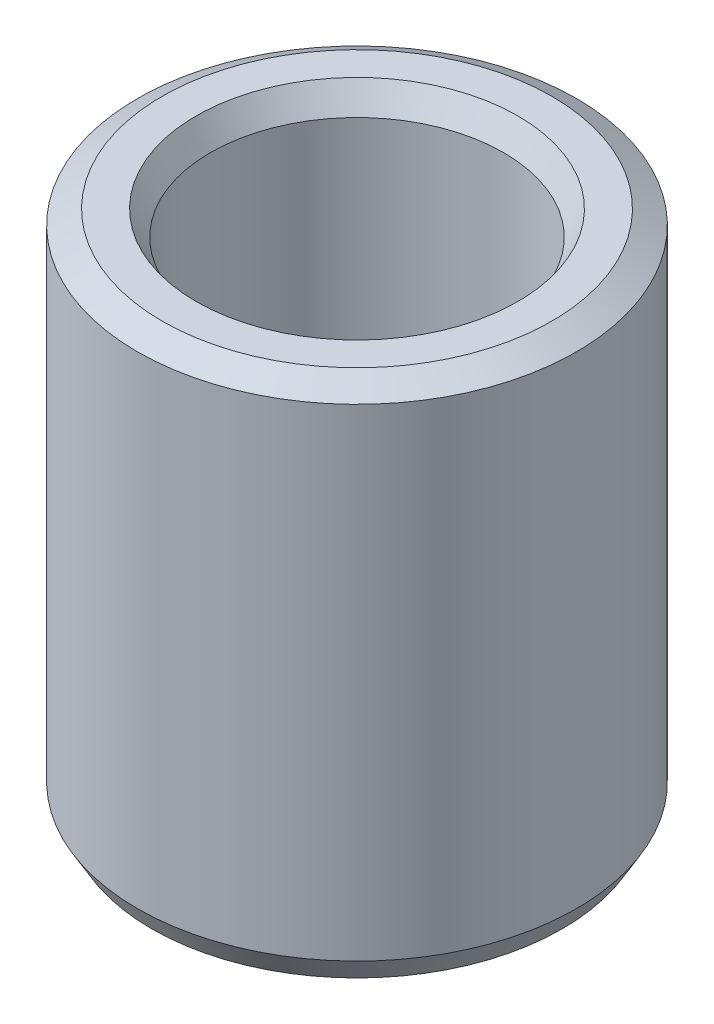
from build123d import *
from OCP.BRepFilletAPI import BRepFilletAPI_MakeChamfer

# Parameters (mm, degrees)
SKETCH1_R           = 35
BOSS_EXTRUDE1_DEPTH = 83.103015643
SKETCH2_R           = 23.377698066
CUT_EXTRUDE1_DEPTH  = 97.726993176
CHAMFER1_SIZE       = 2.271240368
CHAMFER1_SIZE2      = 3.933903713


with BuildPart() as part:
    # Sketch1 → Boss-Extrude1 (new body)
    with BuildSketch(Plane(origin=(0, 0, 0), x_dir=(1, 0, 0), z_dir=(0, 1, 0))):
        Circle(SKETCH1_R)
    extrude(amount=BOSS_EXTRUDE1_DEPTH)

    # Sketch2 → Cut-Extrude1 (cut, through all)
    with BuildSketch(Plane(origin=(0, 0, 0), x_dir=(1, 0, 0), z_dir=(0, 1, 0))):
        Circle(SKETCH2_R)
    extrude(amount=CUT_EXTRUDE1_DEPTH, mode=Mode.SUBTRACT)

    # Chamfer1: one chamfer whose edges measure the first distance from different faces: ONE call of the kernel's chamfer builder (chamfer() names one face for all edges)
    chamfer1_edges_1 = [part.edges().sort_by_distance(p)[0] for p in [
        (-23.377698066, 83.103015643, 0),
    ]]
    chamfer1_side_1 = [part.faces().sort_by_distance(p)[0] for p in [
        (-34.010050506, 83.103015643, 0),
    ]]
    chamfer1_edges_2 = [part.edges().sort_by_distance(p)[0] for p in [
        (-23.377698066, 0, 0),
    ]]
    chamfer1_side_2 = [part.faces().sort_by_distance(p)[0] for p in [
        (-23.377698066, 41.551507821, 0),
    ]]
    chamfer1_edges_3 = [part.edges().sort_by_distance(p)[0] for p in [
        (-35, 0, 0),
    ]]
    chamfer1_side_3 = [part.faces().sort_by_distance(p)[0] for p in [
        (-34.010050506, 0, 0),
    ]]
    chamfer1_edges_4 = [part.edges().sort_by_distance(p)[0] for p in [
        (-35, 83.103015643, 0),
    ]]
    chamfer1_side_4 = [part.faces().sort_by_distance(p)[0] for p in [
        (-35, 41.551507821, 0),
    ]]
    chamfer1 = BRepFilletAPI_MakeChamfer(part.part.solid().wrapped)
    for e in chamfer1_edges_1:
        chamfer1.Add(CHAMFER1_SIZE, CHAMFER1_SIZE2, e.wrapped, chamfer1_side_1[0].wrapped)  # the first distance lies on this face
    for e in chamfer1_edges_2:
        chamfer1.Add(CHAMFER1_SIZE, CHAMFER1_SIZE2, e.wrapped, chamfer1_side_2[0].wrapped)  # the first distance lies on this face
    for e in chamfer1_edges_3:
        chamfer1.Add(CHAMFER1_SIZE, CHAMFER1_SIZE2, e.wrapped, chamfer1_side_3[0].wrapped)  # the first distance lies on this face
    for e in chamfer1_edges_4:
        chamfer1.Add(CHAMFER1_SIZE, CHAMFER1_SIZE2, e.wrapped, chamfer1_side_4[0].wrapped)  # the first distance lies on this face
    add(Compound.cast(chamfer1.Shape()), mode=Mode.REPLACE)


solid = part.part
